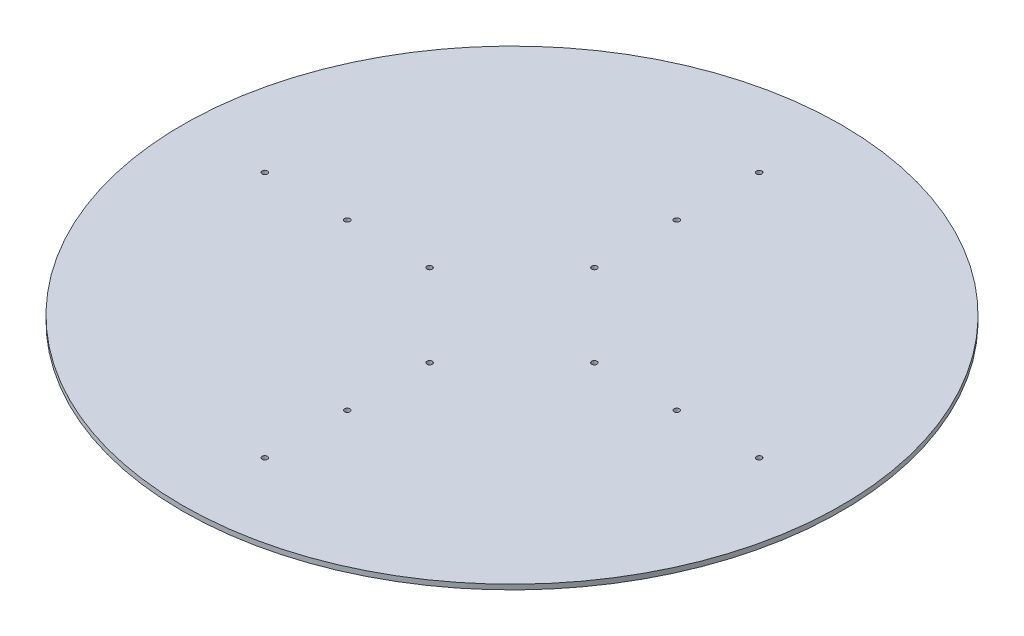
from build123d import *

# Parameters (mm, degrees)
SKETCH3_R                    = 200
BASE_FLANGE1_DEPTH           = 3
F_30_0_1285_DIAMETER_HOLE1_D = 3.2639


# Sheet-metal steps are written as plain solids
with BuildPart() as part:
    # Sketch3 → Base-Flange1 (new body)
    with BuildSketch(Plane(origin=(0, 0, 0), x_dir=(1, 0, 0), z_dir=(0, 1, 0))):
        with Locations(Location((0, 0, 0), (0, 0, 270))):
            Circle(SKETCH3_R)
    extrude(amount=-BASE_FLANGE1_DEPTH)

    # #30 (0.1285) Diameter Hole1 (through all)
    with Locations(Plane(origin=(0, 0, 0), x_dir=(1, 0, 0), z_dir=(0, 1, 0))):
        with Locations((0, 150), (0, 100), (0, 50), (50, 0), (100, 0), (150, 0), (0, -50), (0, -100), (0, -150), (-50, 0), (-100, 0), (-150, 0)):
            Hole(F_30_0_1285_DIAMETER_HOLE1_D / 2)


solid = part.part
